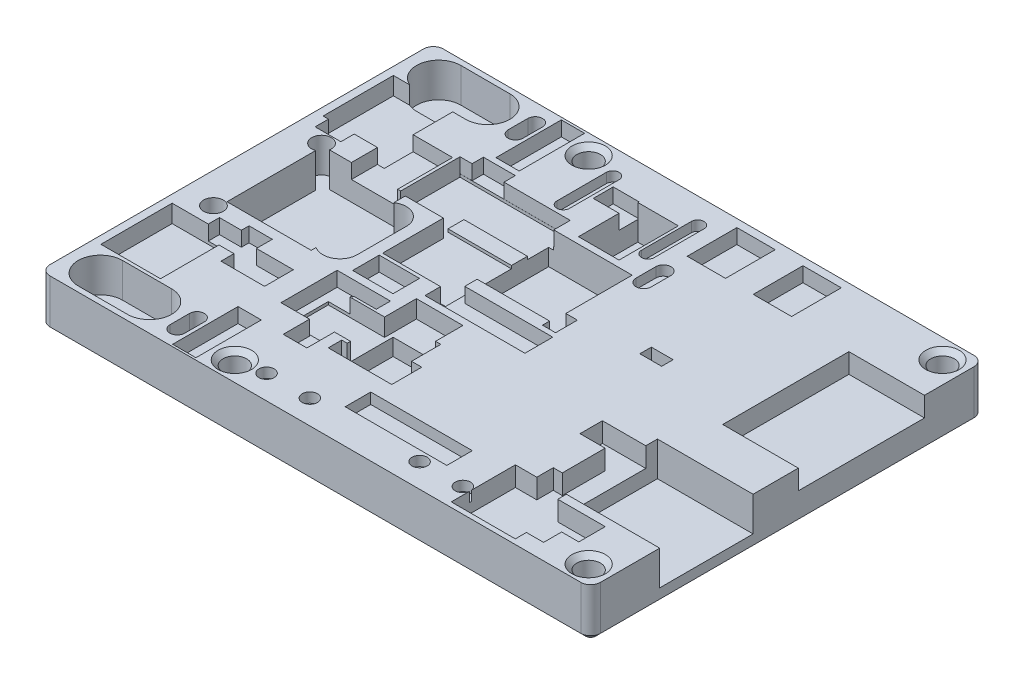
from build123d import *

# Parameters (mm, degrees)
SKETCH_1_W           = 56
SKETCH_1_H           = 40
EXTRUDE_1_DEPTH      = 5
SKETCH_2_R           = 1.2
CUT_EXTRUDE_1_DEPTH  = 10
SKETCH_3_W           = 9.72951698
SKETCH_3_H           = 9.49999997
CUT_EXTRUDE_2_DEPTH  = 3.5
CUT_EXTRUDE_3_DEPTH  = 2
SKETCH_5_W           = 7.689205707
SKETCH_5_H           = 12.834953062
CUT_EXTRUDE_4_DEPTH  = 2
SKETCH_6_W           = 10.33886511
SKETCH_6_H           = 2.6
CUT_EXTRUDE_5_DEPTH  = 1.1
SKETCH_7_W           = 3.9
SKETCH_7_H           = 5.0551716
CUT_EXTRUDE_6_DEPTH  = 1.5
SKETCH_8_R           = 1
CUT_EXTRUDE_7_DEPTH  = 3.5
SKETCH_10_W          = 2.36753883
SKETCH_10_H          = 6.65270691
SKETCH_10_W_2        = 2.214853068
SKETCH_10_H_2        = 1.168063722
SKETCH_10_W_3        = 1.33401813
SKETCH_10_H_3        = 2.22123593
CUT_EXTRUDE_8_DEPTH  = 1.5
SKETCH_11_W          = 4.10200371
SKETCH_11_H          = 2.703641274
SKETCH_11_W_2        = 4.705510737
SKETCH_11_H_2        = 6.06150738
SKETCH_11_W_3        = 2.620918884
SKETCH_11_H_3        = 1.355996642
SKETCH_11_W_4        = 2.649869279
SKETCH_11_H_4        = 2.028841705
CUT_EXTRUDE_9_DEPTH  = 1.5
SKETCH_13_W          = 6.229755284
SKETCH_13_H          = 7.157914366
SKETCH_13_W_2        = 6.067522073
SKETCH_13_H_2        = 7.247781444
CUT_EXTRUDE_10_DEPTH = 1.8
SKETCH_14_W          = 4.12595327
SKETCH_14_H          = 6.034757273
SKETCH_14_W_2        = 8.495690651
SKETCH_14_H_2        = 8.244110551
SKETCH_14_W_3        = 8.565718804
SKETCH_14_H_3        = 9.78939292
SKETCH_14_W_4        = 4.858948124
SKETCH_14_H_4        = 4.796802531
CUT_EXTRUDE_11_DEPTH = 3.5
SKETCH_15_R          = 0.775504691
SKETCH_15_R_2        = 0.775
CUT_EXTRUDE_12_DEPTH = 1
SKETCH_16_OUTSIDE_W  = 71.8
SKETCH_16_OUTSIDE_H  = 55.8
CUT_EXTRUDE_13_DEPTH = 5
CHAMFER_1_SIZE       = 0.5
CHAMFER_3_SIZE       = 0.5


with BuildPart() as part:
    # 草图1 → 凸台-拉伸1 (new body)
    with BuildSketch(Plane(origin=(0, 0, 0), x_dir=(1, 0, 0), z_dir=(0, 1, 0))):
        with Locations((28, 20)):
            Rectangle(SKETCH_1_W, SKETCH_1_H)
    extrude(amount=EXTRUDE_1_DEPTH)

    # 草图2 → 切除-拉伸1 (cut)
    with BuildSketch(Plane(origin=(0, 5, 0), x_dir=(1, 0, 0), z_dir=(0, 1, 0))):
        with Locations(Location((53.8, 38, 0), (0, 0, 270))):
            Circle(SKETCH_2_R)
        with Locations(Location((17.8, 38, 0), (0, 0, 270))):
            Circle(SKETCH_2_R)
        with Locations(Location((17.8, 2, 0), (0, 0, 270))):
            Circle(SKETCH_2_R)
        with Locations(Location((53.8, 2, 0), (0, 0, 270))):
            Circle(SKETCH_2_R)
    extrude(amount=-CUT_EXTRUDE_1_DEPTH, mode=Mode.SUBTRACT)

    # 草图3 → 切除-拉伸2 (cut)
    with BuildSketch(Plane(origin=(0, 5, 0), x_dir=(1, 0, 0), z_dir=(0, 1, 0))):
        with Locations((51.13524151, 11.778516175)):
            Rectangle(SKETCH_3_W, SKETCH_3_H)
    extrude(amount=-CUT_EXTRUDE_2_DEPTH, mode=Mode.SUBTRACT)

    # 草图4 → 切除-拉伸3 (cut)
    with BuildSketch(Plane(origin=(0, 5, 0), x_dir=(1, 0, 0), z_dir=(0, 1, 0))):
        Polygon((43.49601736, 7.02851619), (41.318728196, 7.02851619), (41.318728196, 0.500020244), (47.838872247, 0.500020244), (47.838872247, 1.627130463), (49.586901105, 1.627130463), (49.586901105, 3.462206951), (51.334929963, 3.462206951), (51.334929963, 6.151774776), (47.457983951, 6.151774776), (46.50728567, 6.151774776), (46.50728567, 7.547145112), (47.457983951, 7.547145112), (47.457983951, 15.341086518), (41.859239449, 15.341086518), (41.859239449, 13.060768847), (43.49601736, 13.060768847), (44.415142303, 13.060768847), (44.415142303, 8.703483826), (43.49601736, 8.703483826), align=None)
    extrude(amount=-CUT_EXTRUDE_3_DEPTH, mode=Mode.SUBTRACT)

    # 草图5 → 切除-拉伸4 (cut)
    with BuildSketch(Plane(origin=(0, 5, 0), x_dir=(1, 0, 0), z_dir=(0, 1, 0))):
        with Locations((52.155397147, 27.547514579)):
            Rectangle(SKETCH_5_W, SKETCH_5_H)
    extrude(amount=-CUT_EXTRUDE_4_DEPTH, mode=Mode.SUBTRACT)

    # 草图6 → 切除-拉伸5 (cut)
    with BuildSketch(Plane(origin=(0, 5, 0), x_dir=(1, 0, 0), z_dir=(0, 1, 0))):
        with Locations((32.711721435, 4.7853979)):
            Rectangle(SKETCH_6_W, SKETCH_6_H)
    extrude(amount=-CUT_EXTRUDE_5_DEPTH, mode=Mode.SUBTRACT)

    # 草图7 → 切除-拉伸6 (cut)
    with BuildSketch(Plane(origin=(0, 5, 0), x_dir=(1, 0, 0), z_dir=(0, 1, 0))):
        with Locations((33.63034752, 36.6727839)):
            Rectangle(SKETCH_7_W, SKETCH_7_H)
        with Locations((40.35034752, 36.6727839)):
            Rectangle(SKETCH_7_W, SKETCH_7_H)
    extrude(amount=-CUT_EXTRUDE_6_DEPTH, mode=Mode.SUBTRACT)

    # 草图8 → 切除-拉伸7 (cut)
    with BuildSketch(Plane(origin=(0, 5, 0), x_dir=(1, 0, 0), z_dir=(0, 1, 0))):
        with Locations(Location((3.124, 14.5, 0), (0, 0, 270))):
            Circle(SKETCH_8_R)
        with Locations(Location((3.124, 25.5, 0), (0, 0, 270))):
            Circle(SKETCH_8_R)
        with BuildLine():
            Line((11.4, 1.8), (11.4, 3.8))
            ThreePointArc((11.4, 3.8), (12.15, 4.55), (12.9, 3.8))
            Line((12.9, 3.8), (12.9, 1.8))
            ThreePointArc((12.9, 1.8), (12.15, 1.05), (11.4, 1.8))
        make_face()
        with BuildLine():
            Line((8.320349906, 0.549558188), (3.320349906, 0.549558188))
            ThreePointArc((3.320349906, 0.549558188), (1.070349906, 2.799558188), (3.320349906, 5.049558188))
            Line((3.320349906, 5.049558188), (8.320349906, 5.049558188))
            ThreePointArc((8.320349906, 5.049558188), (10.570349906, 2.799558188), (8.320349906, 0.549558188))
        make_face()
        with BuildLine():
            Line((11.259313615, 17.489240089), (11.259313615, 22.489240089))
            ThreePointArc((11.259313615, 22.489240089), (13.009313615, 24.239240089), (14.759313615, 22.489240089))
            Line((14.759313615, 22.489240089), (14.759313615, 17.489240089))
            ThreePointArc((14.759313615, 17.489240089), (13.009313615, 15.739240089), (11.259313615, 17.489240089))
        make_face()
        with BuildLine():
            Line((11.430090565, 38.181117393), (11.426782196, 36.18112013))
            ThreePointArc((11.426782196, 36.18112013), (12.175540531, 35.429880517), (12.926780144, 36.178638853))
            Line((12.926780144, 36.178638853), (12.930088513, 38.178636116))
            ThreePointArc((12.930088513, 38.178636116), (12.181330178, 38.929875729), (11.430090565, 38.181117393))
        make_face()
        with BuildLine():
            Line((8.352513147, 39.436651805), (3.352519988, 39.444922729))
            ThreePointArc((3.352519988, 39.444922729), (1.09880115, 37.198647723), (3.345076156, 34.944928886))
            Line((3.345076156, 34.944928886), (8.345069315, 34.936657962))
            ThreePointArc((8.345069315, 34.936657962), (10.598788153, 37.182932968), (8.352513147, 39.436651805))
        make_face()
    extrude(amount=-CUT_EXTRUDE_7_DEPTH, mode=Mode.SUBTRACT)

    # 草图10 → 切除-拉伸8 (cut)
    with BuildSketch(Plane(origin=(0, 5, 0), x_dir=(1, 0, 0), z_dir=(0, 1, 0))):
        with Locations((14.443720435, 3.538402345)):
            Rectangle(SKETCH_10_W, SKETCH_10_H)
        with Locations((14.443720435, 36.432094326)):
            Rectangle(SKETCH_10_W, SKETCH_10_H)
        with Locations((38.970952846, 23.730712695)):
            Rectangle(SKETCH_10_W_2, SKETCH_10_H_2)
        with Locations((31.05620413, 21.819045565)):
            Rectangle(SKETCH_10_W_3, SKETCH_10_H_3)
    extrude(amount=-CUT_EXTRUDE_8_DEPTH, mode=Mode.SUBTRACT)

    # 草图11 → 切除-拉伸9 (cut)
    with BuildSketch(Plane(origin=(0, 5, 0), x_dir=(1, 0, 0), z_dir=(0, 1, 0))):
        Polygon((12.582210247, 31.355424242), (11.367884896, 31.355424242), (11.367884896, 25.11176806), (22.570036263, 25.11176806), (22.570036263, 31.355424242), (15.830530562, 31.355424242), (15.830530562, 32.509033326), (12.582210247, 32.509033326), align=None)
        Polygon((31.970650784, 20.178778602), (23.015288892, 20.178778602), (23.015288892, 24.423650361), (21.803236945, 24.423650361), (21.803236945, 20.178778602), (21.803236945, 17.343485193), (31.970650784, 17.343485193), align=None)
        Polygon((27.952357897, 10.868497441), (26.610280344, 10.868497441), (26.610280344, 9.185591757), (21.490035713, 9.185591757), (21.490035713, 7.81283182), (26.610280344, 7.81283182), (27.952357897, 7.81283182), align=None)
        Polygon((20.413817494, 9.782679367), (18.124343347, 9.782679367), (18.124343347, 13.522267561), (18.245619787, 13.522267561), (18.245619787, 13.655856381), (20.533028259, 13.655856381), (20.533028259, 15.100686006), (18.245619787, 15.100686006), (15.107914653, 15.100686006), (15.107914653, 13.522267561), (15.107914653, 9.389180397), (18.00858473, 9.389180397), (18.00858473, 6.71609211), (20.413817494, 6.71609211), align=None)
        with Locations((17.9641195, 17.226497265)):
            Rectangle(SKETCH_11_W, SKETCH_11_H)
        Polygon((6.709615991, 12.549542904), (6.709615991, 11.317874928), (8.394444826, 11.317874928), (8.394444826, 9.993250878), (12.833097345, 9.993250878), (12.833097345, 12.921367199), (9.07999587, 12.921367199), (9.07999587, 14.536478979), (6.709615991, 14.536478979), (6.709615991, 13.757971862), (4.478670222, 13.757971862), (4.478670222, 12.549542904), align=None)
        with Locations((8.691309434, 27.879417924)):
            Rectangle(SKETCH_11_W_2, SKETCH_11_H_2)
        with Locations((2.660160188, 27.297553693)):
            Rectangle(SKETCH_11_W_3, SKETCH_11_H_3)
        with Locations((23.128171585, 35.477270957)):
            Rectangle(SKETCH_11_W_4, SKETCH_11_H_4)
    extrude(amount=-CUT_EXTRUDE_9_DEPTH, mode=Mode.SUBTRACT)

    # 草图13 → 切除-拉伸10 (cut)
    with BuildSketch(Plane(origin=(0, 5, 0), x_dir=(1, 0, 0), z_dir=(0, 1, 0))):
        Polygon((18.120987698, 9.525446187), (15.911321885, 9.525446187), (15.911321885, 13.397622469), (18.120987698, 13.397622469), (21.637524266, 13.397622469), (21.637524266, 13.800374893), (21.637524266, 16.635897171), (26.372066051, 16.635897171), (26.372066051, 13.800374893), (22.540319323, 13.800374893), (22.540319323, 13.397622469), (22.540319323, 9.525446187), align=None)
        Polygon((22.540319323, 31.348526644), (11.355201423, 31.348526644), (11.355201423, 27.518439235), (11.355201423, 25.129895713), (15.59565534, 25.129895713), (15.911321885, 25.129895713), (15.911321885, 18.924038095), (22.312375323, 18.924038095), (22.312375323, 25.896789042), (15.911321885, 25.896789042), (15.59565534, 25.896789042), (15.59565534, 27.518439235), (22.540319323, 27.518439235), align=None)
        with Locations((3.916515514, 31.551854627)):
            Rectangle(SKETCH_13_W, SKETCH_13_H)
        with Locations((3.835398909, 8.99566465)):
            Rectangle(SKETCH_13_W_2, SKETCH_13_H_2)
    extrude(amount=-CUT_EXTRUDE_10_DEPTH, mode=Mode.SUBTRACT)

    # 草图14 → 切除-拉伸11 (cut)
    with BuildSketch(Plane(origin=(0, 5, 0), x_dir=(1, 0, 0), z_dir=(0, 1, 0))):
        with Locations((26.488440988, 33.355967866)):
            Rectangle(SKETCH_14_W, SKETCH_14_H)
        with Locations((26.29913584, 25.557407839)):
            Rectangle(SKETCH_14_W_2, SKETCH_14_H_2)
        with Locations((7.747501999, 20.43037755)):
            Rectangle(SKETCH_14_W_3, SKETCH_14_H_3)
        with Locations((24.480764576, 11.448609547)):
            Rectangle(SKETCH_14_W_4, SKETCH_14_H_4)
    extrude(amount=-CUT_EXTRUDE_11_DEPTH, mode=Mode.SUBTRACT)

    # 草图15 → 切除-拉伸12 (cut)
    with BuildSketch(Plane(origin=(0, 5, 0), x_dir=(1, 0, 0), z_dir=(0, 1, 0))):
        with Locations((40.552, 2.449)):
            Circle(SKETCH_15_R)
        with Locations(Location((36.158, 2.439, 0), (0, 0, 270))):
            Circle(SKETCH_15_R_2)
        with Locations(Location((24.982, 2.449, 0), (0, 0, 270))):
            Circle(SKETCH_15_R_2)
        with Locations(Location((20.588, 2.439, 0), (0, 0, 270))):
            Circle(SKETCH_15_R_2)
        with BuildLine():
            Line((28.821979448, 32.34790012), (28.821979448, 37.422344181))
            ThreePointArc((28.821979448, 37.422344181), (29.47100024, 38.071364973), (30.120021032, 37.422344181))
            Line((30.120021032, 37.422344181), (30.120021032, 32.34790012))
            ThreePointArc((30.120021032, 32.34790012), (29.47100024, 31.698879328), (28.821979448, 32.34790012))
        make_face()
        with BuildLine():
            Line((20.176002137, 32.387212691), (20.17100008, 37.421698368))
            ThreePointArc((20.17100008, 37.421698368), (20.820353948, 38.072343861), (21.470999441, 37.422989994))
            Line((21.470999441, 37.422989994), (21.476001498, 32.388504317))
            ThreePointArc((21.476001498, 32.388504317), (20.826647631, 31.737858508), (20.176002137, 32.387212691))
        make_face()
        with BuildLine():
            Line((32.55, 31.627), (32.55, 29.627))
            ThreePointArc((32.55, 29.627), (31.775, 28.852), (31, 29.627))
            Line((31, 29.627), (31, 31.627))
            ThreePointArc((31, 31.627), (31.775, 32.402), (32.55, 31.627))
        make_face()
    extrude(amount=-CUT_EXTRUDE_12_DEPTH, mode=Mode.SUBTRACT)

    # 草图16 outside → 切除-拉伸13 (cut)
    with BuildSketch(Plane.XZ):
        with Locations((28, -20)):
            Rectangle(SKETCH_16_OUTSIDE_W, SKETCH_16_OUTSIDE_H)
        with BuildLine():
            Line((0, -1.000363504), (0, -38.999636496))
            ThreePointArc((0, -38.999636496), (0.292999706, -39.70700036), (1.000363571, -40.000000066))
            Line((1.000363571, -40.000000066), (54.999637835, -40.000000066))
            ThreePointArc((54.999637835, -40.000000066), (55.707001699, -39.70700036), (56.000001405, -38.999636496))
            Line((56.000001405, -38.999636496), (56.000001405, -1.000363504))
            ThreePointArc((56.000001405, -1.000363504), (55.707001699, -0.29299964), (54.999637835, 6.6e-08))
            Line((54.999637835, 6.6e-08), (1.000363571, 6.6e-08))
            ThreePointArc((1.000363571, 6.6e-08), (0.292999706, -0.29299964), (0, -1.000363504))
        make_face(mode=Mode.SUBTRACT)
    extrude(amount=-CUT_EXTRUDE_13_DEPTH, mode=Mode.SUBTRACT)

    # 倒角1
    chamfer_1_edges = [part.edges().sort_by_distance(p)[0] for p in [
        (0, 0, -20),
        (28.000000703, 0, -40.000000066),
        (56, 0, -20),
        (28.000000703, 0, 6.6e-08),
        (0.292999706, 0, -0.29299964),
        (55.706408659, 0, -0.292407097),
        (55.706408659, 0, -39.707592903),
        (0.292999706, 0, -39.70700036),
    ]]
    chamfer(chamfer_1_edges, length=CHAMFER_1_SIZE)

    # 倒角2
    # the kernel refuses this chamfer: 0.5 mm, written as the material it takes off along each edge
    with BuildSketch(Plane(origin=(53.8, 0, -2), x_dir=(0, 0, 1), z_dir=(-1, 0, 0))) as chamfer_2_piece_1:
        with BuildLine():
            Line((1.714142136, -0.014142136), (1.185857864, 0.514142136))
            Line((1.185857864, 0.514142136), (1.175857864, 0.514142136))
            ThreePointArc((1.175857864, 0.514142136), (1.19, 0.257071068), (1.19, 0))
            Line((1.19, 0), (1.2, -0.01))
            ThreePointArc((1.2, -0.01), (1.457071068, -0.01), (1.714142136, -0.024142136))
            Line((1.714142136, -0.024142136), (1.714142136, -0.014142136))
        make_face()
    revolve(axis=Axis((53.8, 0, -2), (0, 1, 0)), mode=Mode.SUBTRACT)
    with BuildSketch(Plane(origin=(17.8, 0, -2), x_dir=(0, 0, 1), z_dir=(-1, 0, 0))) as chamfer_2_piece_2:
        with BuildLine():
            Line((1.714142136, -0.014142136), (1.185857864, 0.514142136))
            Line((1.185857864, 0.514142136), (1.175857864, 0.514142136))
            ThreePointArc((1.175857864, 0.514142136), (1.19, 0.257071068), (1.19, 0))
            Line((1.19, 0), (1.2, -0.01))
            ThreePointArc((1.2, -0.01), (1.457071068, -0.01), (1.714142136, -0.024142136))
            Line((1.714142136, -0.024142136), (1.714142136, -0.014142136))
        make_face()
    revolve(axis=Axis((17.8, 0, -2), (0, 1, 0)), mode=Mode.SUBTRACT)
    with BuildSketch(Plane(origin=(17.8, 0, -38), x_dir=(0, 0, 1), z_dir=(-1, 0, 0))) as chamfer_2_piece_3:
        with BuildLine():
            Line((1.714142136, -0.014142136), (1.185857864, 0.514142136))
            Line((1.185857864, 0.514142136), (1.175857864, 0.514142136))
            ThreePointArc((1.175857864, 0.514142136), (1.19, 0.257071068), (1.19, 0))
            Line((1.19, 0), (1.2, -0.01))
            ThreePointArc((1.2, -0.01), (1.457071068, -0.01), (1.714142136, -0.024142136))
            Line((1.714142136, -0.024142136), (1.714142136, -0.014142136))
        make_face()
    revolve(axis=Axis((17.8, 0, -38), (0, 1, 0)), mode=Mode.SUBTRACT)
    with BuildSketch(Plane(origin=(53.8, 0, -38), x_dir=(0, 0, 1), z_dir=(-1, 0, 0))) as chamfer_2_piece_4:
        with BuildLine():
            Line((1.714142136, -0.014142136), (1.185857864, 0.514142136))
            Line((1.185857864, 0.514142136), (1.175857864, 0.514142136))
            ThreePointArc((1.175857864, 0.514142136), (1.19, 0.257071068), (1.19, 0))
            Line((1.19, 0), (1.2, -0.01))
            ThreePointArc((1.2, -0.01), (1.457071068, -0.01), (1.714142136, -0.024142136))
            Line((1.714142136, -0.024142136), (1.714142136, -0.014142136))
        make_face()
    revolve(axis=Axis((53.8, 0, -38), (0, 1, 0)), mode=Mode.SUBTRACT)

    # 倒角3
    chamfer_3_edges = [part.edges().sort_by_distance(p)[0] for p in [
        (53.8, 5, -3.2),
        (17.8, 5, -3.2),
        (17.8, 5, -39.2),
        (53.8, 5, -39.2),
    ]]
    chamfer(chamfer_3_edges, length=CHAMFER_3_SIZE)


solid = part.part
